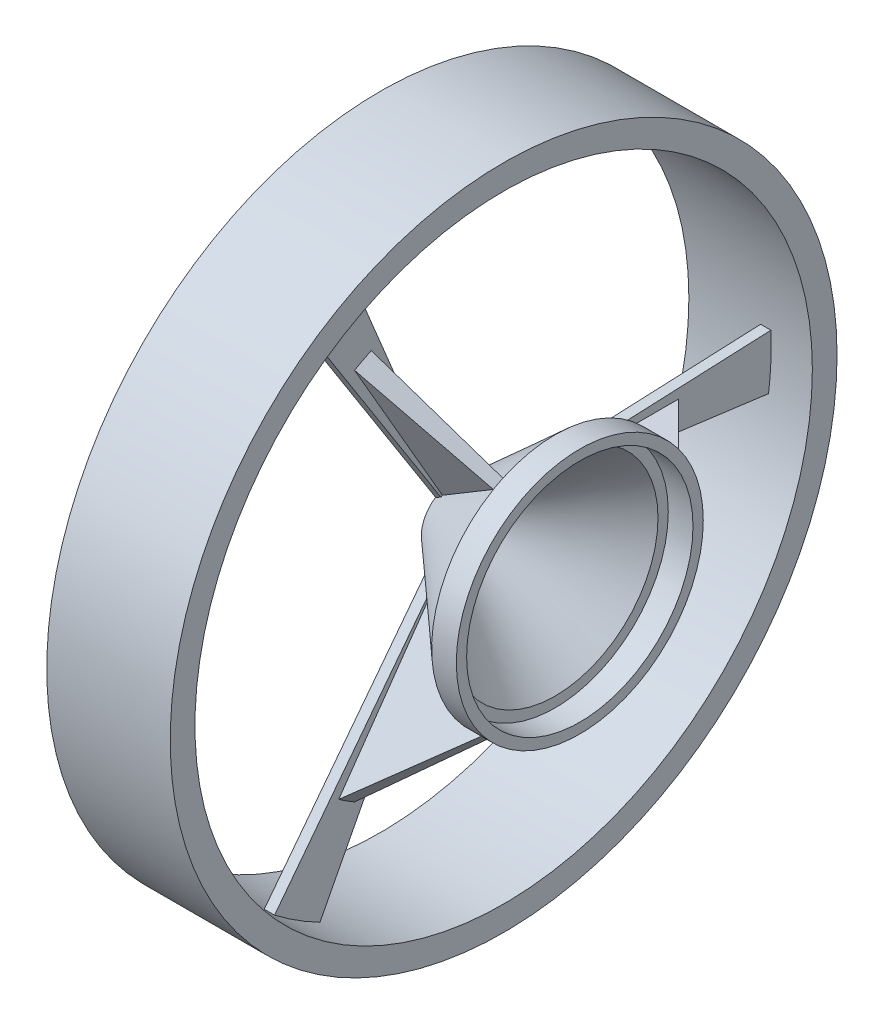
from build123d import *

# Parameters (mm, degrees)
SKETCH_5_R               = 30
SKETCH_5_R_2             = 27.5
EXTRUDE_1_DEPTH          = 6
REVOLVE_1_OUTLINE_W      = 67.5
REVOLVE_1_OUTLINE_H      = 2.5
REVOLVE_1_ANGLE          = 10
REVOLVE_2_ANGLE          = 5
PATTERN_CIRCULAR_1_COUNT = 3
EXTRUDE_2_DEPTH          = 10
EXTRUDE_2_DEPTH_BACK     = 20
SKETCH_14_R              = 81
SKETCH_14_R_2            = 75


# Read off the part's stored shape, not the designer's step: 旋轉1
with BuildPart() as part:
    # 草圖5 → 填料-伸長1 (new body)
    with BuildSketch(Plane.ZY):
        Circle(SKETCH_5_R)
        Circle(SKETCH_5_R_2, mode=Mode.SUBTRACT)
    extrude(amount=EXTRUDE_1_DEPTH)

    # 草圖13 → 旋轉3 (revolve)
    with BuildSketch(Plane(origin=(0, 0, 0), x_dir=(1, 0, 0), z_dir=(0, 1, 0))):
        Polygon((-6, 30), (-31, 7.5), (-25.444444444, 7.5), (-6, 25), align=None)
    revolve(axis=Axis((-1000, 0, 0), (1, 0, 0)))

    # 旋轉1 outline → 旋轉1 (revolve)
    with BuildSketch(Plane(origin=(0, 0, 0), x_dir=(0, -0.13052619222005293, -0.9914448613738103), z_dir=(0, -0.9914448613738103, 0.13052619222005293))):
        with Locations((41.25, -29.75)):
            Rectangle(REVOLVE_1_OUTLINE_W, REVOLVE_1_OUTLINE_H)
    revolve_1 = revolve(axis=Axis((0, 0, 0), (1, 0, 0)), revolution_arc=REVOLVE_1_ANGLE)

    # 草圖12 → 旋轉2 (revolve)
    with BuildSketch(Plane(origin=(0, 0, 0), x_dir=(1, 0, 0), z_dir=(0, 1, 0))):
        Polygon((-31, 54.917629386), (-6, 30), (-31, 7.5), align=None)
    revolve_2 = revolve(axis=Axis((0, 0, 0), (-1, 0, 0)), revolution_arc=REVOLVE_2_ANGLE)

    # 環狀複製排列1: 旋轉1, 旋轉2 ×3 about axis
    pattern_circular_1_axis = Axis((0, 0, 0), (1, 0, 0))
    add([revolve_1.rotate(pattern_circular_1_axis, i * 360 / PATTERN_CIRCULAR_1_COUNT) for i in range(1, PATTERN_CIRCULAR_1_COUNT)])
    add([revolve_2.rotate(pattern_circular_1_axis, i * 360 / PATTERN_CIRCULAR_1_COUNT) for i in range(1, PATTERN_CIRCULAR_1_COUNT)])

    # 草圖14 → 填料-伸長2 (add, two sides: drawn at the far end of the back side and taken through both)
    with BuildSketch(Plane(origin=(-28.5, 0, 0), x_dir=(0, 0, -1), z_dir=(1, 0, 0)).offset(-EXTRUDE_2_DEPTH_BACK)):
        Circle(SKETCH_14_R)
        Circle(SKETCH_14_R_2, mode=Mode.SUBTRACT)
    extrude(amount=EXTRUDE_2_DEPTH + EXTRUDE_2_DEPTH_BACK)


solid = part.part
